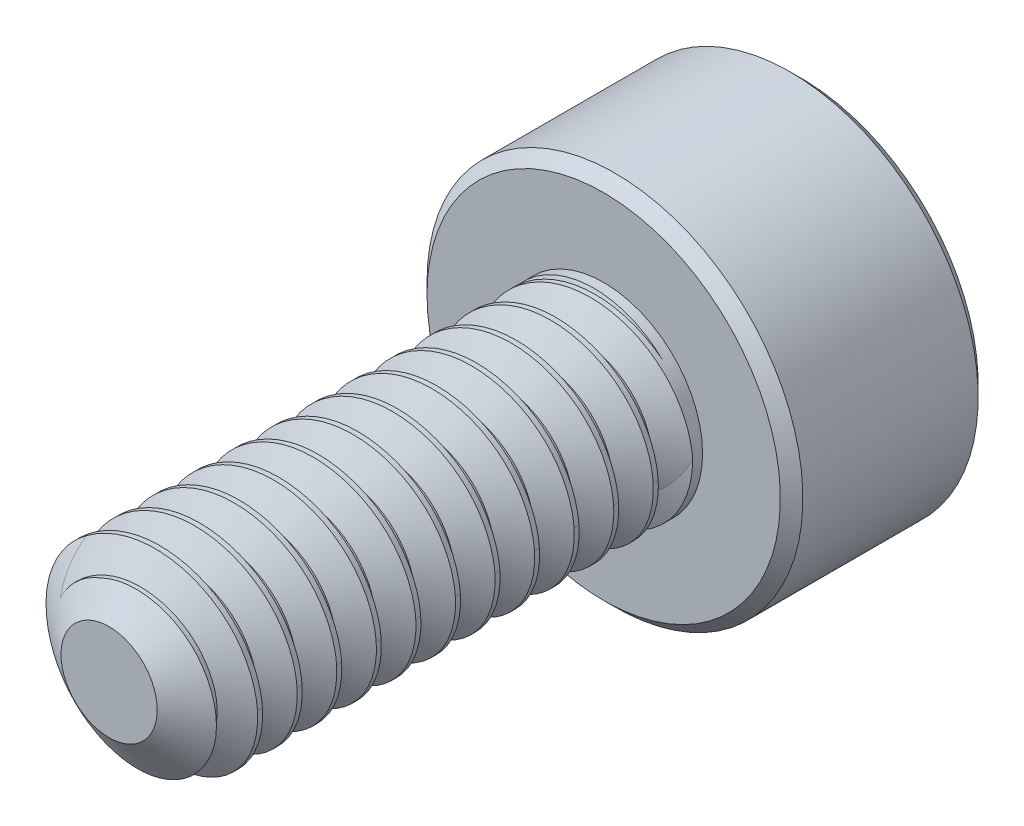
from build123d import *

# Parameters (mm, degrees)
SKETCH1_R          = 1
EXTRUDE1_DEPTH     = 5
CUT_SWEEP1_PITCH   = 0.4
SKETCH6_R          = 1.9
EXTRUDE2_DEPTH     = 2
CUT_EXTRUDE1_DEPTH = 1.125
CHAMFER1_SIZE      = 0.114


with BuildPart() as part:
    # Sketch1 → Extrude1 (new body)
    with BuildSketch(Plane.XY):
        Circle(SKETCH1_R)
    extrude(amount=-EXTRUDE1_DEPTH)

    # Cut-Sweep1: the profile of Sketch3 profile screwed along a right-hand helix of 13.5 turns, 6 arcs to a turn; built about Z, then put on its axis
    cut_sweep1_z = Axis((0, 0, 0), (0, 0, 1))
    cut_sweep1_corners = [(1.0003, 0, -0.350173205), (0.740192379, 0, -0.2), (0.740192379, 0, -0.15), (1.0003, 0, 0.000173205)]
    with BuildLine(mode=Mode.PRIVATE) as cut_sweep1_profile:
        Line(cut_sweep1_corners[0], cut_sweep1_corners[1])
        Line(cut_sweep1_corners[1], cut_sweep1_corners[2])
        Line(cut_sweep1_corners[2], cut_sweep1_corners[3])
        Line(cut_sweep1_corners[3], cut_sweep1_corners[0])
    cut_sweep1_cap = Face(cut_sweep1_profile.wire())
    cut_sweep1_turn_angles = [0, 30, 60, 90, 120, 150, 180, 210, 240, 270, 300, 330, 360]
    cut_sweep1_turn_weights = [1, 0.8660254037844387, 1, 0.8660254037844387, 1, 0.8660254037844387, 1, 0.8660254037844387, 1, 0.8660254037844387, 1, 0.8660254037844387, 1]
    cut_sweep1_turn_rails = [Edge.make_bspline([Vector(p[0], p[1], 0).rotate(cut_sweep1_z, cut_sweep1_turn_angles[k]) / cut_sweep1_turn_weights[k] + Vector(0, 0, p[2] + CUT_SWEEP1_PITCH * cut_sweep1_turn_angles[k] / 360) for k in range(13)], [0, 0, 0, 1, 1, 2, 2, 3, 3, 4, 4, 5, 5, 6, 6, 6], 2, cut_sweep1_turn_weights) for p in cut_sweep1_corners]
    cut_sweep1_turn_sides = [Face.make_surface_from_curves(cut_sweep1_turn_rails[p[0]], cut_sweep1_turn_rails[p[1]]) for p in [(0, 1), (1, 2), (2, 3), (3, 0)]]
    cut_sweep1_last_angles = [4680, 4710, 4740, 4770, 4800, 4830, 4860]
    cut_sweep1_last_weights = [1, 0.8660254037844387, 1, 0.8660254037844387, 1, 0.8660254037844347, 1]
    cut_sweep1_last_rails = [Edge.make_bspline([Vector(p[0], p[1], 0).rotate(cut_sweep1_z, cut_sweep1_last_angles[k]) / cut_sweep1_last_weights[k] + Vector(0, 0, p[2] + CUT_SWEEP1_PITCH * cut_sweep1_last_angles[k] / 360) for k in range(7)], [0, 0, 0, 1, 1, 2, 2, 3, 3, 3], 2, cut_sweep1_last_weights) for p in cut_sweep1_corners]
    cut_sweep1_last_sides = [Face.make_surface_from_curves(cut_sweep1_last_rails[p[0]], cut_sweep1_last_rails[p[1]]) for p in [(0, 1), (1, 2), (2, 3), (3, 0)]]
    cut_sweep1 = Plane(origin=(0, 0, 0), x_dir=(0, 1, 0), z_dir=(0, 0, -1)) * Solid(Shell([*[p.moved(Location((0, 0, CUT_SWEEP1_PITCH * i))) for i in range(13) for p in cut_sweep1_turn_sides], *cut_sweep1_last_sides, cut_sweep1_cap, cut_sweep1_cap.rotate(cut_sweep1_z, 4860).moved(Location((0, 0, CUT_SWEEP1_PITCH * 4860 / 360)))]))
    add(cut_sweep1, mode=Mode.SUBTRACT)

    # Sketch4 → Cut-Revolve1 (revolve, cut)
    with BuildSketch(Plane(origin=(0, 0, 0), x_dir=(0, 0, -1), z_dir=(1, 0, 0)), mode=Mode.PRIVATE) as cut_revolve1_sk:
        Polygon((0.35977197, 1), (0, 0.486192379), (0, 1), align=None)
    revolve(cut_revolve1_sk.sketch.rotate(Axis((0, 0, 0), (0, 0, -1)), 278.428757723), axis=Axis((0, 0, 0), (0, 0, -1)), mode=Mode.SUBTRACT)

    # Sketch6 → Extrude2 (add)
    with BuildSketch(Plane(origin=(0, 0, -5), x_dir=(-1, 0, 0), z_dir=(0, 0, -1))):
        Circle(SKETCH6_R)
    extrude(amount=EXTRUDE2_DEPTH)

    # Sketch7 → Cut-Extrude1 (cut)
    with BuildSketch(Plane(origin=(0, 0, -7), x_dir=(-1, 0, 0), z_dir=(0, 0, -1))):
        Polygon((0, 0.866025404), (-0.75, 0.433012702), (-0.75, -0.433012702), (0, -0.866025404), (0.75, -0.433012702), (0.75, 0.433012702), align=None)
    extrude(amount=-CUT_EXTRUDE1_DEPTH, mode=Mode.SUBTRACT)

    # Cut-Extrude2 cone 1 section (through the dimple's axis) → Cut-Extrude2 (revolve, cut)
    with BuildSketch(Plane(origin=(0, 0, -7), x_dir=(0, 1, 0), z_dir=(1, 0, 0))):
        Polygon((0, 0), (0.866025404, 0), (0, 0.866025404), align=None)
    revolve(axis=Axis((0, 0, -7), (0, 0, 1)), mode=Mode.SUBTRACT)

    # Chamfer1
    chamfer1_edges = [part.edges().sort_by_distance(p)[0] for p in [
        (1.9, 0, -5),
        (1.9, 0, -7),
    ]]
    chamfer(chamfer1_edges, length=CHAMFER1_SIZE)

    # Sketch10 → Revolve1 (revolve)
    with BuildSketch(Plane(origin=(0, 0, 0), x_dir=(0, 0, -1), z_dir=(1, 0, 0)), mode=Mode.PRIVATE) as revolve1_sk:
        Polygon((5, 1), (5, 0), (4.485786438, 0), (4.9, 1), align=None)
    revolve(revolve1_sk.sketch.rotate(Axis((0, 0, -5), (0, 0, 1)), 270), axis=Axis((0, 0, -5), (0, 0, 1)))


solid = part.part
